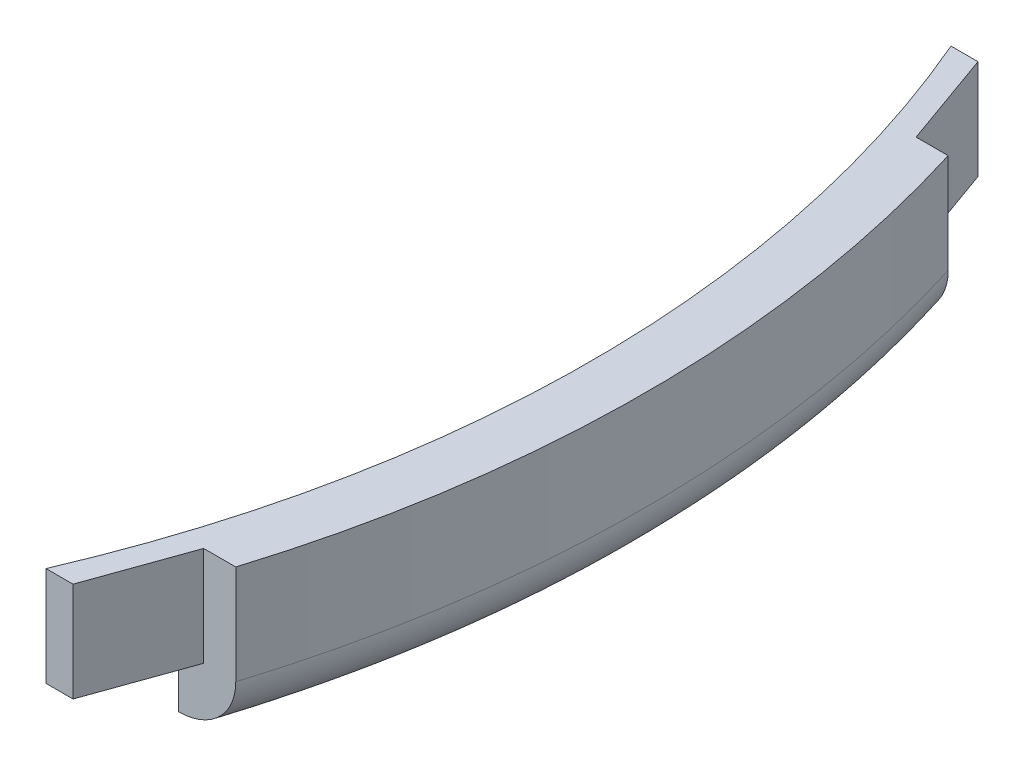
from build123d import *

# Parameters (mm, degrees)
BOSS_EXTRUDE1_DEPTH = 3.6
BOSS_EXTRUDE2_START = 1.2
BOSS_EXTRUDE2_DEPTH = 1.2
FILLET1_R           = 1.7
CUT_EXTRUDE1_DEPTH  = 0.5


with BuildPart() as part:
    # Sketch1 → Boss-Extrude1 (new body)
    with BuildSketch(Plane(origin=(0, 0, 0), x_dir=(1, 0, 0), z_dir=(0, 1, 0))):
        with BuildLine():
            Line((34.819547736, 11.1), (35.819547736, 11.1))
            ThreePointArc((35.819547736, 11.1), (37.5, 0), (35.819547736, -11.1))
            Line((35.819547736, -11.1), (34.819547736, -11.1))
            Line((34.819547736, -11.1), (33.748237365, -14.1))
            Line((33.748237365, -14.1), (32.90638236, -14.1))
            ThreePointArc((32.90638236, -14.1), (35.8, 0), (32.90638236, 14.1))
            Line((32.90638236, 14.1), (33.748237365, 14.1))
            Line((33.748237365, 14.1), (34.819547736, 11.1))
        make_face()
    extrude(amount=BOSS_EXTRUDE1_DEPTH)

    # Sketch2 → Boss-Extrude2 (add)
    with BuildSketch(Plane.XZ.offset(BOSS_EXTRUDE2_START)):
        with BuildLine():
            Line((35.819547736, 11.1), (34.035716534, 11.1))
            ThreePointArc((34.035716534, 11.1), (35.8, 0), (34.035716534, -11.1))
            Line((34.035716534, -11.1), (35.819547736, -11.1))
            ThreePointArc((35.819547736, -11.1), (37.5, 0), (35.819547736, 11.1))
        make_face()
    extrude(amount=-BOSS_EXTRUDE2_DEPTH)

    # Fillet1
    fillet1_edges = [part.edges().sort_by_distance(p)[0] for p in [
        (37.5, -1.2, 0),
    ]]
    fillet(fillet1_edges, radius=FILLET1_R - 0.0001)  # a hair under: the kernel refuses the full size

    # Sketch5 → Cut-Extrude1 (cut)
    with BuildSketch(Plane.XZ):
        with BuildLine():
            Line((34.819547736, -11.1), (34.035716534, -11.1))
            ThreePointArc((34.035716534, -11.1), (33.504643724, -12.612646388), (32.90638236, -14.1))
            Line((32.90638236, -14.1), (33.748237365, -14.1))
            Line((33.748237365, -14.1), (34.819547736, -11.1))
        make_face()
        with BuildLine():
            Line((34.035716534, 11.1), (34.819547736, 11.1))
            Line((34.819547736, 11.1), (33.748237365, 14.1))
            Line((33.748237365, 14.1), (32.90638236, 14.1))
            ThreePointArc((32.90638236, 14.1), (33.504643724, 12.612646388), (34.035716534, 11.1))
        make_face()
    extrude(amount=-CUT_EXTRUDE1_DEPTH, mode=Mode.SUBTRACT)


solid = part.part
